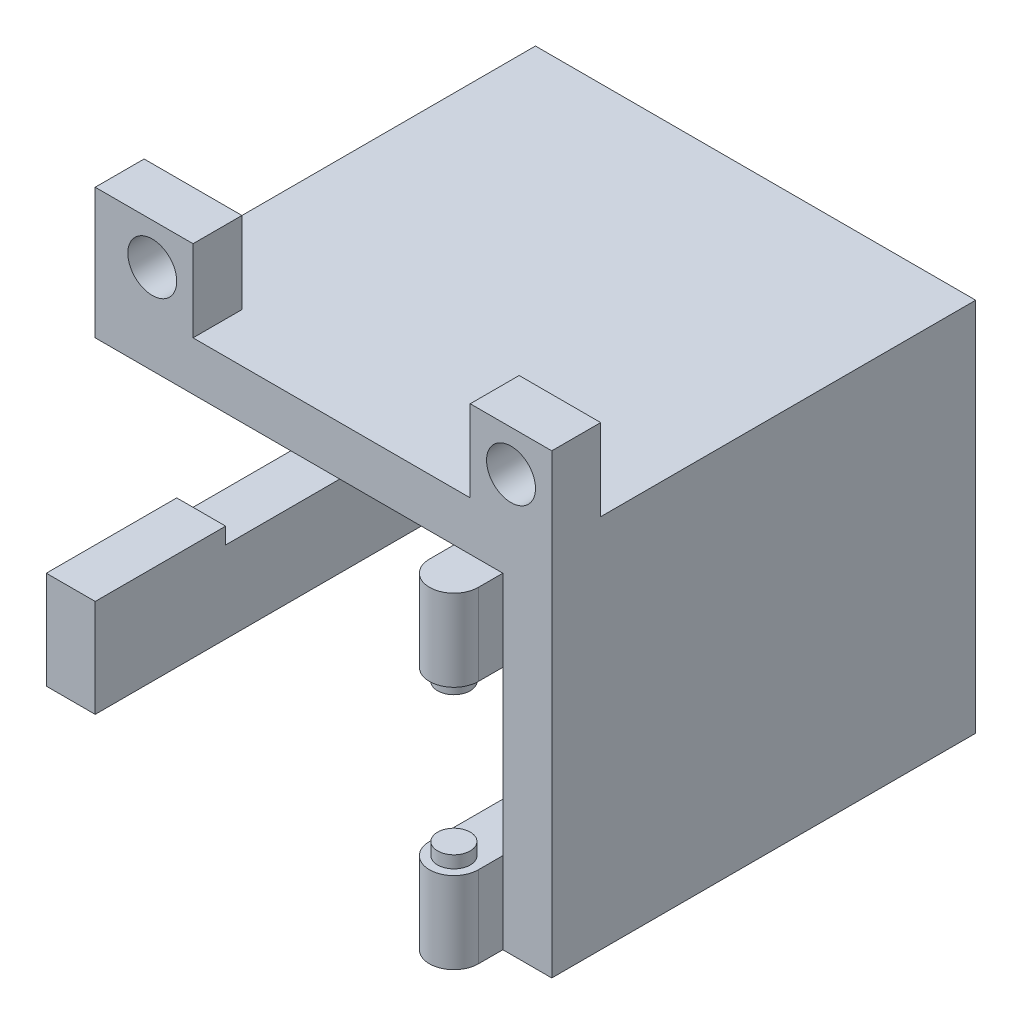
from build123d import *

# Parameters (mm, degrees)
CROQUIS1_W              = 31
CROQUIS1_H              = 26
SALIENTE_EXTRUIR1_DEPTH = 23
CROQUIS2_W              = 25
CROQUIS2_H              = 20
CORTAR_EXTRUIR1_DEPTH   = 23
CORTAR_EXTRUIR3_REACH   = 40.016
CROQUIS6_W              = 5
CROQUIS6_H              = 5
SALIENTE_EXTRUIR2_DEPTH = 3
CROQUIS7_R              = 1.5
CORTAR_EXTRUIR4_DEPTH   = 3
CROQUIS8_W              = 3
CROQUIS8_H              = 8
SALIENTE_EXTRUIR3_DEPTH = 1
SALIENTE_EXTRUIR4_DEPTH = 1
SALIENTE_EXTRUIR5_DEPTH = 5
CROQUIS12_R             = 1
SALIENTE_EXTRUIR7_DEPTH = 0.75


with BuildPart() as part:
    # Croquis1 → Saliente-Extruir1 (new body)
    with BuildSketch(Plane(origin=(0, 0, 0), x_dir=(1, 0, 0), z_dir=(0, 1, 0))):
        Rectangle(CROQUIS1_W, CROQUIS1_H)
    extrude(amount=SALIENTE_EXTRUIR1_DEPTH)

    # Croquis2 → Cortar-Extruir1 (cut)
    with BuildSketch(Plane.XY.offset(13)):
        with Locations((0, 10)):
            Rectangle(CROQUIS2_W, CROQUIS2_H)
    extrude(amount=-CORTAR_EXTRUIR1_DEPTH, mode=Mode.SUBTRACT)

    # Croquis5 → Cortar-Extruir3 (cut, up to next)
    with BuildSketch(Plane.XY.offset(13), mode=Mode.PRIVATE) as cortar_extruir3_sk1:
        Polygon((-15.5, 23), (-11.5, 23), (-11.5, 20), (-9.5, 20), (-9.5, 11), (-11.5, 11), (-11.5, 5), (-15.5, 5), align=None)
    cortar_extruir3_tool1 = extrude(cortar_extruir3_sk1.sketch, amount=-CORTAR_EXTRUIR3_REACH, mode=Mode.PRIVATE) & part.part
    add(cortar_extruir3_tool1.solids().sort_by_distance((-12.9, 14.3, 13))[0], mode=Mode.SUBTRACT)

    # Croquis6 → Saliente-Extruir2 (add)
    with BuildSketch(Plane.XY.offset(13)):
        with Locations((-9, 25.5)):
            Rectangle(CROQUIS6_W, CROQUIS6_H)
        with Locations((13, 25.5)):
            Rectangle(CROQUIS6_W, CROQUIS6_H)
    extrude(amount=-SALIENTE_EXTRUIR2_DEPTH)

    # Croquis7 → Cortar-Extruir4 (cut)
    with BuildSketch(Plane.XY.offset(13)):
        with Locations((-9, 25.5)):
            Circle(CROQUIS7_R)
        with Locations((13, 25.5)):
            Circle(CROQUIS7_R)
    extrude(amount=-CORTAR_EXTRUIR4_DEPTH, mode=Mode.SUBTRACT)

    # Croquis8 → Saliente-Extruir3 (add)
    with BuildSketch(Plane(origin=(0, 5, 0), x_dir=(1, 0, 0), z_dir=(0, 1, 0))):
        with Locations((-14, -9)):
            Rectangle(CROQUIS8_W, CROQUIS8_H)
    extrude(amount=SALIENTE_EXTRUIR3_DEPTH)

    # Croquis9 → Saliente-Extruir4 (add)
    with BuildSketch(Plane.ZY.offset(11.5)):
        Polygon((10, 23), (10, 28), (13, 28), (13, 20), (5, 20), (5, 23), align=None)
    extrude(amount=SALIENTE_EXTRUIR4_DEPTH)

    # Croquis10 → Saliente-Extruir5 (add)
    with BuildSketch(Plane.XZ):
        with BuildLine():
            Line((9.5, 10), (9.5, 13))
            Line((9.5, 13), (9.5, 14.5))
            ThreePointArc((9.5, 14.5), (11, 16), (12.5, 14.5))
            Line((12.5, 14.5), (12.5, 13))
            Line((12.5, 13), (12.5, 10))
            Line((12.5, 10), (9.5, 10))
        make_face()
    saliente_extruir5 = extrude(amount=-SALIENTE_EXTRUIR5_DEPTH)

    # Croquis12 → Saliente-Extruir7 (add)
    with BuildSketch(Plane(origin=(0, 5, 0), x_dir=(1, 0, 0), z_dir=(0, 1, 0))):
        with Locations((11, -14.5)):
            Circle(CROQUIS12_R)
    saliente_extruir7 = extrude(amount=SALIENTE_EXTRUIR7_DEPTH)

    # Simetría1: Saliente-Extruir5, Saliente-Extruir7 across plane
    add(saliente_extruir5.mirror(Plane(origin=(0, 10, 0), x_dir=(0, 0, 1), z_dir=(0, -1, 0))))
    add(saliente_extruir7.mirror(Plane(origin=(0, 10, 0), x_dir=(0, 0, 1), z_dir=(0, -1, 0))))


solid = part.part
